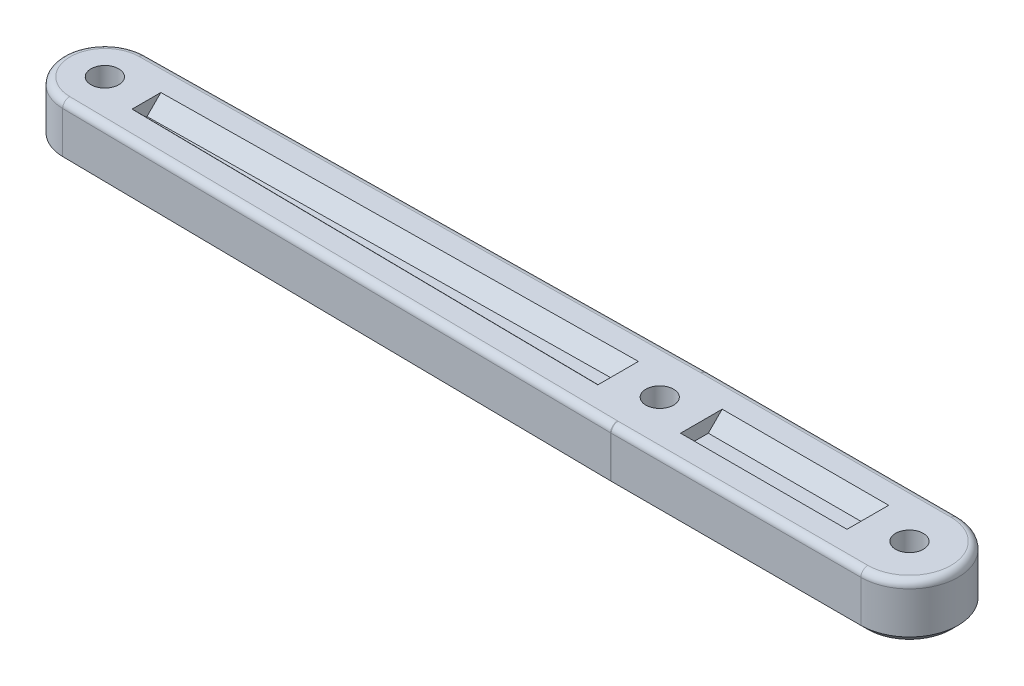
from build123d import *

# Parameters (mm, degrees)
SKETCH1_R           = 2
BOSS_EXTRUDE1_DEPTH = 8
SKETCH2_W           = 24
SKETCH2_H           = 6
CUT_EXTRUDE1_DEPTH  = 2
SKETCH3_W           = 24
SKETCH3_H           = 6
CUT_EXTRUDE2_DEPTH  = 2
FILLET2_R           = 1
CHAMFER1_SIZE       = 1
CHAMFER2_SIZE       = 2
CHAMFER3_SIZE       = 2
CHAMFER5_SIZE       = 2
CHAMFER6_SIZE       = 2
CHAMFER7_SIZE       = 2
CHAMFER8_SIZE       = 2
CHAMFER9_SIZE       = 2
CHAMFER10_SIZE      = 2


with BuildPart() as part:
    # Sketch1 → Boss-Extrude1 (new body)
    with BuildSketch(Plane(origin=(0, 0, 0), x_dir=(1, 0, 0), z_dir=(0, 1, 0))):
        with BuildLine():
            Line((0, 7), (36, 7))
            ThreePointArc((36, 7), (43, 0), (36, -7))
            Line((36, -7), (0, -7))
            ThreePointArc((0, -7), (-0.043750855, -6.999863275), (-0.0875, -6.999453104))
            Line((-0.0875, -6.999453104), (-80.075, -5.999531232))
            ThreePointArc((-80.075, -5.999531232), (-86, 0), (-80.075, 5.999531232))
            Line((-80.075, 5.999531232), (-0.0875, 6.999453104))
            ThreePointArc((-0.0875, 6.999453104), (-0.043750855, 6.999863275), (0, 7))
        make_face()
        with Locations(Location((0, 0, 0), (0, 0, 270))):
            Circle(SKETCH1_R, mode=Mode.SUBTRACT)
        with Locations(Location((-80, 0, 0), (0, 0, 270))):
            Circle(SKETCH1_R, mode=Mode.SUBTRACT)
        with Locations(Location((36, 0, 0), (0, 0, 270))):
            Circle(SKETCH1_R, mode=Mode.SUBTRACT)
    extrude(amount=BOSS_EXTRUDE1_DEPTH)

    # Sketch2 → Cut-Extrude1 (cut)
    with BuildSketch(Plane(origin=(0, 8, 0), x_dir=(1, 0, 0), z_dir=(0, 1, 0))):
        Polygon((-74, 2.075162128), (-6, 2.925228542), (-6, -2.925228542), (-74, -2.075162128), align=None)
        with Locations((18, 0)):
            Rectangle(SKETCH2_W, SKETCH2_H)
    extrude(amount=-CUT_EXTRUDE1_DEPTH, mode=Mode.SUBTRACT)

    # Sketch3 → Cut-Extrude2 (cut)
    with BuildSketch(Plane.XZ):
        Polygon((-74, 2.075162128), (-6, 2.925228542), (-6, -2.925228542), (-74, -2.075162128), align=None)
        with Locations((18, 0)):
            Rectangle(SKETCH3_W, SKETCH3_H)
    extrude(amount=-CUT_EXTRUDE2_DEPTH, mode=Mode.SUBTRACT)

    # Fillet2
    fillet2_edges = [part.edges().sort_by_distance(p)[0] for p in [
        (-86, 8, 0),
        (-40.08125, 8, 6.499492168),
        (-0.043750855, 8, 6.999863275),
        (18, 8, 7),
        (43, 8, 0),
        (18, 8, -7),
        (-0.043750855, 8, -6.999863275),
        (-40.08125, 8, -6.499492168),
    ]]
    fillet(fillet2_edges, radius=FILLET2_R)

    # Chamfer1
    chamfer1_edges = [part.edges().sort_by_distance(p)[0] for p in [
        (-40.08125, 0, 6.499492168),
        (-86, 0, 0),
        (-40.08125, 0, -6.499492168),
        (-0.043750855, 0, -6.999863275),
        (18, 0, -7),
        (43, 0, 0),
        (18, 0, 7),
        (-0.043750855, 0, 6.999863275),
    ]]
    chamfer(chamfer1_edges, length=CHAMFER1_SIZE)

    # Chamfer2
    chamfer2_edges = [part.edges().sort_by_distance(p)[0] for p in [
        (18, 2, -3),
    ]]
    chamfer(chamfer2_edges, length=CHAMFER2_SIZE - 0.0001)  # a hair under: the kernel refuses the full size

    # Chamfer3
    chamfer3_edges = [part.edges().sort_by_distance(p)[0] for p in [
        (18, 2, 3),
    ]]
    chamfer(chamfer3_edges, length=CHAMFER3_SIZE - 0.0001)  # a hair under: the kernel refuses the full size

    # Chamfer5
    chamfer5_edges = [part.edges().sort_by_distance(p)[0] for p in [
        (-40, 2, -2.500195335),
    ]]
    chamfer(chamfer5_edges, length=CHAMFER5_SIZE - 0.0001)  # a hair under: the kernel refuses the full size

    # Chamfer6
    chamfer6_edges = [part.edges().sort_by_distance(p)[0] for p in [
        (-40, 2, 2.500195335),
    ]]
    chamfer(chamfer6_edges, length=CHAMFER6_SIZE - 0.0001)  # a hair under: the kernel refuses the full size

    # Chamfer7
    chamfer7_edges = [part.edges().sort_by_distance(p)[0] for p in [
        (-40, 6, -2.500195335),
    ]]
    chamfer(chamfer7_edges, length=CHAMFER7_SIZE - 0.0001)  # a hair under: the kernel refuses the full size

    # Chamfer8
    chamfer8_edges = [part.edges().sort_by_distance(p)[0] for p in [
        (18, 6, -3),
    ]]
    chamfer(chamfer8_edges, length=CHAMFER8_SIZE - 0.0001)  # a hair under: the kernel refuses the full size

    # Chamfer9
    chamfer9_edges = [part.edges().sort_by_distance(p)[0] for p in [
        (18, 6, 3),
    ]]
    chamfer(chamfer9_edges, length=CHAMFER9_SIZE - 0.0001)  # a hair under: the kernel refuses the full size

    # Chamfer10
    chamfer10_edges = [part.edges().sort_by_distance(p)[0] for p in [
        (-40, 6, 2.500195335),
    ]]
    chamfer(chamfer10_edges, length=CHAMFER10_SIZE - 0.0001)  # a hair under: the kernel refuses the full size


solid = part.part
